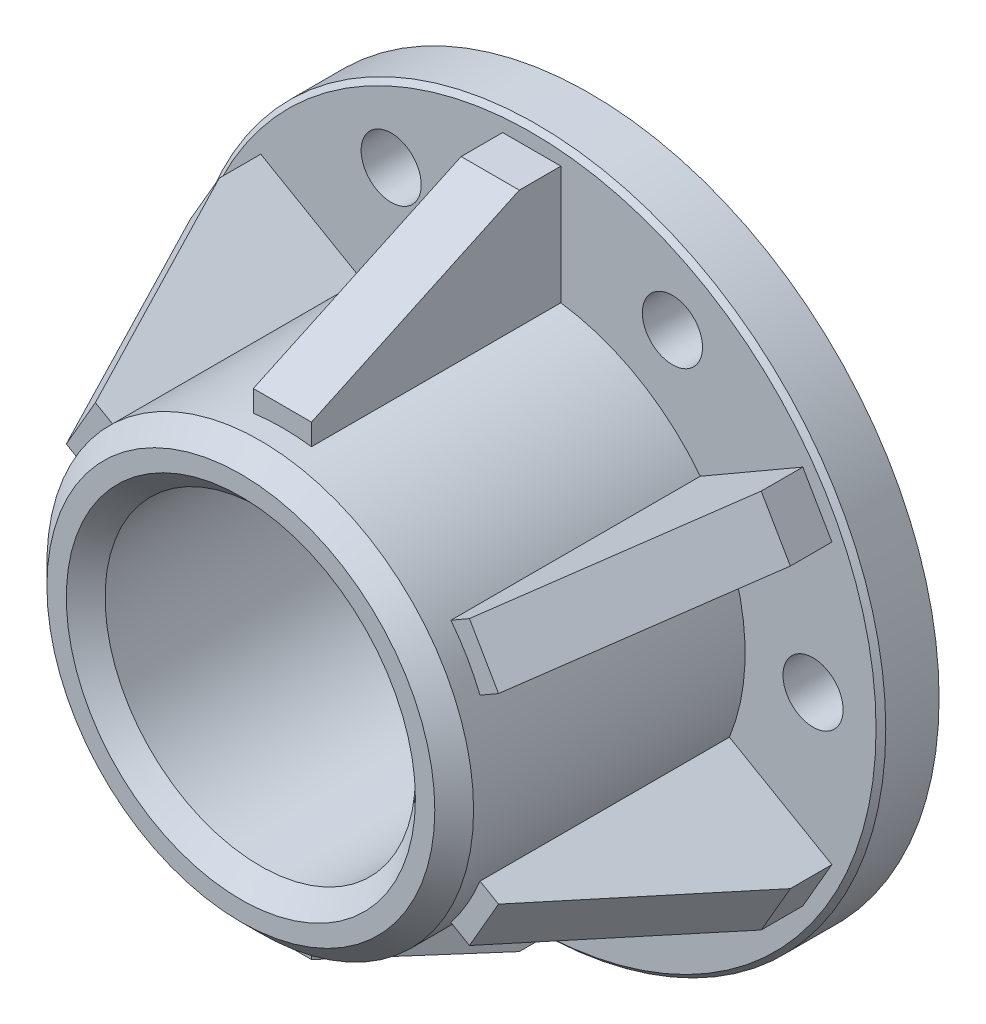
from build123d import *

# Parameters (mm, degrees)
SKETCH1_R                = 18
SKETCH1_R_2              = 8
BOSS_EXTRUDE1_DEPTH      = 3
SKETCH2_R                = 11
SKETCH2_R_2              = 8
BOSS_EXTRUDE2_DEPTH      = 15
BOSS_EXTRUDE4_DEPTH      = 1.5
CIRPATTERN1_COUNT        = 6
M_0_295_DIAMETER_HOLE1_D = 3.099999896
CHAMFER1_SIZE            = 1
CHAMFER6_SIZE            = 0.25


with BuildPart() as part:
    # Sketch1 → Boss-Extrude1 (new body)
    with BuildSketch(Plane.XY):
        with Locations((163, 28)):
            Circle(SKETCH1_R)
        with Locations((163, 28)):
            Circle(SKETCH1_R_2, mode=Mode.SUBTRACT)
    extrude(amount=BOSS_EXTRUDE1_DEPTH)

    # Sketch2 → Boss-Extrude2 (add)
    with BuildSketch(Plane.XY.offset(3)):
        with Locations((163, 28)):
            Circle(SKETCH2_R)
        with Locations((163, 28)):
            Circle(SKETCH2_R_2, mode=Mode.SUBTRACT)
    extrude(amount=BOSS_EXTRUDE2_DEPTH)

    # Sketch6 → Boss-Extrude4 (add, symmetric)
    with BuildSketch(Plane(origin=(163, 0, 0), x_dir=(0, 0, -1), z_dir=(1, 0, 0))):
        Polygon((-15.857142857, 40), (-5.142857143, 45), (-3, 45), (-2.9, 45), (-2.9, 38.9), (-3, 38.9), (-15.857142857, 38.9), (-15.857142857, 39), align=None)
    boss_extrude4 = extrude(amount=BOSS_EXTRUDE4_DEPTH, both=True)

    # CirPattern1: Boss-Extrude4 ×6 about axis
    cirpattern1_axis = Axis((163, 28, 18), (0, 0, 1))
    for i in range(1, CIRPATTERN1_COUNT):
        add(boss_extrude4.rotate(cirpattern1_axis, i * 360 / CIRPATTERN1_COUNT))

    # M (0.295) Diameter Hole1 (through all)
    with Locations(Plane.XY.offset(3)):
        with Locations((155.75, 40.557368355), (170.25, 40.557368355), (177.5, 28), (170.25, 15.442631645), (155.75, 15.442631645), (148.5, 28)):
            Hole(M_0_295_DIAMETER_HOLE1_D / 2)

    # Chamfer1
    chamfer1_edges = [part.edges().sort_by_distance(p)[0] for p in [
        (155, 28, 18),
        (152, 28, 18),
    ]]
    chamfer(chamfer1_edges, length=CHAMFER1_SIZE)

    # Chamfer6
    chamfer6_edges = [part.edges().sort_by_distance(p)[0] for p in [
        (145, 28, 3),
    ]]
    chamfer(chamfer6_edges, length=CHAMFER6_SIZE)


solid = part.part
